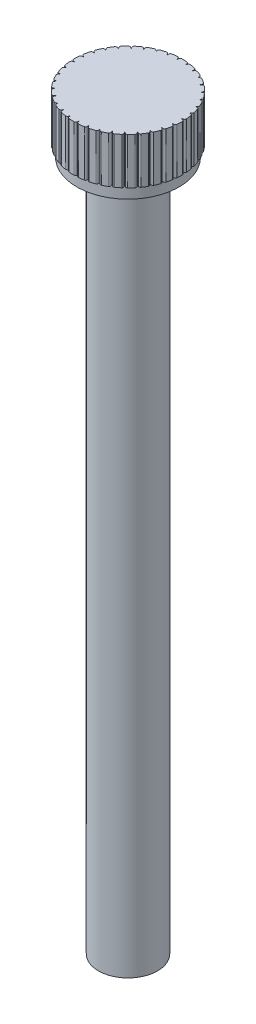
from build123d import *
from OCP.BRepAlgoAPI import BRepAlgoAPI_Cut
from OCP.TopTools import TopTools_ListOfShape

# Parameters (mm, degrees)
ENL_V_MAT_EXTRU_2_DEPTH = 10


with BuildPart() as part:
    # Esquisse1 → Révolution1 (revolve)
    with BuildSketch(Plane.XY):
        Polygon((0, 33.024224269), (-2.75, 33.024224269), (-2.75, 30.675), (-2.6, 30.675), (-2.6, 30.075), (-1.5, 30.075), (-1.5, -4.925), (0, -4.925), align=None)
    revolve(axis=Axis((0, 33.024224269, 0), (0, -1, 0)))


with BuildPart() as enl_v_mat_extru_2_tool:
    # Esquisse2 → Enlèv. mat.-Extru.2 (new body)
    with BuildSketch(Plane(origin=(0, 33.024224269, 0), x_dir=(1, 0, 0), z_dir=(0, 1, 0))):
        with BuildLine():
            Line((0.329583196, 2.654689846), (0.339367819, 2.577754505))
            Line((0.339367819, 2.577754505), (0.36873137, 2.649535892))
            ThreePointArc((0.36873137, 2.649535892), (0.404129914, 2.693729763), (0.457853835, 2.71161539))
            ThreePointArc((0.457853835, 2.71161539), (0.358946748, 2.726471234), (0.259564862, 2.737720628))
            ThreePointArc((0.259564862, 2.737720628), (0.306829044, 2.706539666), (0.329583196, 2.654689846))
        make_face()
        with BuildLine():
            Line((0.785558141, 2.557127621), (0.781834431, 2.479662018))
            Line((0.781834431, 2.479662018), (0.823216591, 2.545253958))
            ThreePointArc((0.823216591, 2.545253958), (0.865751537, 2.582629532), (0.921765077, 2.590914375))
            ThreePointArc((0.921765077, 2.590914375), (0.826940301, 2.622719561), (0.731021687, 2.651055535))
            ThreePointArc((0.731021687, 2.651055535), (0.772153302, 2.612140943), (0.785558141, 2.557127621))
        make_face()
        with BuildLine():
            Line((1.217664299, 2.381868367), (1.2005454, 2.306226256))
            Line((1.2005454, 2.306226256), (1.252688793, 2.36363577))
            ThreePointArc((1.252688793, 2.36363577), (1.301067738, 2.39305741), (1.357668954, 2.391489738))
            ThreePointArc((1.357668954, 2.391489738), (1.269807692, 2.439277881), (1.180266787, 2.483839461))
            ThreePointArc((1.180266787, 2.483839461), (1.214016073, 2.438373638), (1.217664299, 2.381868367))
        make_face()
        with BuildLine():
            Line((1.612772344, 2.134237248), (1.582778404, 2.062716976))
            Line((1.582778404, 2.062716976), (1.644098679, 2.110199706))
            ThreePointArc((1.644098679, 2.110199706), (1.696851654, 2.130773449), (1.752320747, 2.119400896))
            ThreePointArc((1.752320747, 2.119400896), (1.674092619, 2.181719977), (1.593650079, 2.241153181))
            ThreePointArc((1.593650079, 2.241153181), (1.618991579, 2.190517585), (1.612772344, 2.134237248))
        make_face()
        with BuildLine():
            Line((1.958877117, 1.82175841), (1.916919488, 1.756533085))
            Line((1.916919488, 1.756533085), (1.985553459, 1.792646291))
            ThreePointArc((1.985553459, 1.792646291), (2.041077591, 1.803747015), (2.093729161, 1.782915129))
            ThreePointArc((2.093729161, 1.782915129), (2.027511089, 1.857871616), (1.958611119, 1.930370597))
            ThreePointArc((1.958611119, 1.930370597), (1.974774846, 1.876103764), (1.958877117, 1.82175841))
        make_face()
        with BuildLine():
            Line((2.2454624, 1.453926365), (2.192815943, 1.396977825))
            Line((2.192815943, 1.396977825), (2.266678202, 1.420624226))
            ThreePointArc((2.266678202, 1.420624226), (2.323286418, 1.42191464), (2.371520673, 1.392256389))
            ThreePointArc((2.371520673, 1.392256389), (2.31932466, 1.477572766), (2.264060751, 1.560934678))
            ThreePointArc((2.264060751, 1.560934678), (2.270555579, 1.504685478), (2.2454624, 1.453926365))
        make_face()
        with BuildLine():
            Line((2.463820444, 1.041917502), (2.402084795, 0.9949761))
            Line((2.402084795, 0.9949761), (2.478931075, 1.005437213))
            ThreePointArc((2.478931075, 1.005437213), (2.534903363, 0.996878109), (2.57725473, 0.959294643))
            ThreePointArc((2.57725473, 0.959294643), (2.540666725, 1.052378615), (2.500718044, 1.144070549))
            ThreePointArc((2.500718044, 1.144070549), (2.497346629, 1.087548087), (2.463820444, 1.041917502))
        make_face()
        with BuildLine():
            Line((2.607316551, 0.598250504), (2.538367516, 0.56274253))
            Line((2.538367516, 0.56274253), (2.615862882, 0.559700498))
            ThreePointArc((2.615862882, 0.559700498), (2.669498552, 0.541551941), (2.704680206, 0.497185214))
            ThreePointArc((2.704680206, 0.497185214), (2.684811917, 0.595208472), (2.661392284, 0.692444416))
            ThreePointArc((2.661392284, 0.692444416), (2.648257065, 0.637366096), (2.607316551, 0.598250504))
        make_face()
        with BuildLine():
            Line((2.671590664, 0.136405967), (2.597523225, 0.113410313))
            Line((2.597523225, 0.113410313), (2.673313018, 0.096957568))
            ThreePointArc((2.673313018, 0.096957568), (2.722982379, 0.069770992), (2.749925343, 0.019969065))
            ThreePointArc((2.749925343, 0.019969065), (2.747380458, 0.119953221), (2.741201466, 0.219778709))
            ThreePointArc((2.741201466, 0.219778709), (2.718701551, 0.16781806), (2.671590664, 0.136405967))
        make_face()
        with BuildLine():
            Line((2.654689846, -0.329583196), (2.577754505, -0.339367819))
            Line((2.577754505, -0.339367819), (2.649535892, -0.36873137))
            ThreePointArc((2.649535892, -0.36873137), (2.693729763, -0.404129914), (2.71161539, -0.457853835))
            ThreePointArc((2.71161539, -0.457853835), (2.726471234, -0.358946748), (2.737720628, -0.259564862))
            ThreePointArc((2.737720628, -0.259564862), (2.706539666, -0.306829044), (2.654689846, -0.329583196))
        make_face()
        with BuildLine():
            Line((2.557127621, -0.785558141), (2.479662018, -0.781834431))
            Line((2.479662018, -0.781834431), (2.545253958, -0.823216591))
            ThreePointArc((2.545253958, -0.823216591), (2.582629532, -0.865751537), (2.590914375, -0.921765077))
            ThreePointArc((2.590914375, -0.921765077), (2.622719561, -0.826940301), (2.651055535, -0.731021687))
            ThreePointArc((2.651055535, -0.731021687), (2.612140943, -0.772153302), (2.557127621, -0.785558141))
        make_face()
        with BuildLine():
            Line((2.381868367, -1.217664299), (2.306226256, -1.2005454))
            Line((2.306226256, -1.2005454), (2.36363577, -1.252688793))
            ThreePointArc((2.36363577, -1.252688793), (2.39305741, -1.301067738), (2.391489738, -1.357668954))
            ThreePointArc((2.391489738, -1.357668954), (2.439277881, -1.269807692), (2.483839461, -1.180266787))
            ThreePointArc((2.483839461, -1.180266787), (2.438373638, -1.214016073), (2.381868367, -1.217664299))
        make_face()
        with BuildLine():
            Line((2.134237248, -1.612772344), (2.062716976, -1.582778404))
            Line((2.062716976, -1.582778404), (2.110199706, -1.644098679))
            ThreePointArc((2.110199706, -1.644098679), (2.130773449, -1.696851654), (2.119400896, -1.752320747))
            ThreePointArc((2.119400896, -1.752320747), (2.181719977, -1.674092619), (2.241153181, -1.593650079))
            ThreePointArc((2.241153181, -1.593650079), (2.190517585, -1.618991579), (2.134237248, -1.612772344))
        make_face()
        with BuildLine():
            Line((1.82175841, -1.958877117), (1.756533085, -1.916919488))
            Line((1.756533085, -1.916919488), (1.792646291, -1.985553459))
            ThreePointArc((1.792646291, -1.985553459), (1.803747015, -2.041077591), (1.782915129, -2.093729161))
            ThreePointArc((1.782915129, -2.093729161), (1.857871616, -2.027511089), (1.930370597, -1.958611119))
            ThreePointArc((1.930370597, -1.958611119), (1.876103764, -1.974774846), (1.82175841, -1.958877117))
        make_face()
        with BuildLine():
            Line((1.453926365, -2.2454624), (1.396977825, -2.192815943))
            Line((1.396977825, -2.192815943), (1.420624226, -2.266678202))
            ThreePointArc((1.420624226, -2.266678202), (1.42191464, -2.323286418), (1.392256389, -2.371520673))
            ThreePointArc((1.392256389, -2.371520673), (1.477572766, -2.31932466), (1.560934678, -2.264060751))
            ThreePointArc((1.560934678, -2.264060751), (1.504685478, -2.270555579), (1.453926365, -2.2454624))
        make_face()
        with BuildLine():
            Line((1.041917502, -2.463820444), (0.9949761, -2.402084795))
            Line((0.9949761, -2.402084795), (1.005437213, -2.478931075))
            ThreePointArc((1.005437213, -2.478931075), (0.996878109, -2.534903363), (0.959294643, -2.57725473))
            ThreePointArc((0.959294643, -2.57725473), (1.052378615, -2.540666725), (1.144070549, -2.500718044))
            ThreePointArc((1.144070549, -2.500718044), (1.087548087, -2.497346629), (1.041917502, -2.463820444))
        make_face()
        with BuildLine():
            Line((0.598250504, -2.607316551), (0.56274253, -2.538367516))
            Line((0.56274253, -2.538367516), (0.559700498, -2.615862882))
            ThreePointArc((0.559700498, -2.615862882), (0.541551941, -2.669498552), (0.497185214, -2.704680206))
            ThreePointArc((0.497185214, -2.704680206), (0.595208472, -2.684811917), (0.692444416, -2.661392284))
            ThreePointArc((0.692444416, -2.661392284), (0.637366096, -2.648257065), (0.598250504, -2.607316551))
        make_face()
        with BuildLine():
            Line((0.136405967, -2.671590664), (0.113410313, -2.597523225))
            Line((0.113410313, -2.597523225), (0.096957568, -2.673313018))
            ThreePointArc((0.096957568, -2.673313018), (0.069770992, -2.722982379), (0.019969065, -2.749925343))
            ThreePointArc((0.019969065, -2.749925343), (0.119953221, -2.747380458), (0.219778709, -2.741201466))
            ThreePointArc((0.219778709, -2.741201466), (0.16781806, -2.718701551), (0.136405967, -2.671590664))
        make_face()
        with BuildLine():
            Line((-0.329583196, -2.654689846), (-0.339367819, -2.577754505))
            Line((-0.339367819, -2.577754505), (-0.36873137, -2.649535892))
            ThreePointArc((-0.36873137, -2.649535892), (-0.404129914, -2.693729763), (-0.457853835, -2.71161539))
            ThreePointArc((-0.457853835, -2.71161539), (-0.358946748, -2.726471234), (-0.259564862, -2.737720628))
            ThreePointArc((-0.259564862, -2.737720628), (-0.306829044, -2.706539666), (-0.329583196, -2.654689846))
        make_face()
        with BuildLine():
            Line((-0.785558141, -2.557127621), (-0.781834431, -2.479662018))
            Line((-0.781834431, -2.479662018), (-0.823216591, -2.545253958))
            ThreePointArc((-0.823216591, -2.545253958), (-0.865751537, -2.582629532), (-0.921765077, -2.590914375))
            ThreePointArc((-0.921765077, -2.590914375), (-0.826940301, -2.622719561), (-0.731021687, -2.651055535))
            ThreePointArc((-0.731021687, -2.651055535), (-0.772153302, -2.612140943), (-0.785558141, -2.557127621))
        make_face()
        with BuildLine():
            Line((-1.217664299, -2.381868367), (-1.2005454, -2.306226256))
            Line((-1.2005454, -2.306226256), (-1.252688793, -2.36363577))
            ThreePointArc((-1.252688793, -2.36363577), (-1.301067738, -2.39305741), (-1.357668954, -2.391489738))
            ThreePointArc((-1.357668954, -2.391489738), (-1.269807692, -2.439277881), (-1.180266787, -2.483839461))
            ThreePointArc((-1.180266787, -2.483839461), (-1.214016073, -2.438373638), (-1.217664299, -2.381868367))
        make_face()
        with BuildLine():
            Line((-1.612772344, -2.134237248), (-1.582778404, -2.062716976))
            Line((-1.582778404, -2.062716976), (-1.644098679, -2.110199706))
            ThreePointArc((-1.644098679, -2.110199706), (-1.696851654, -2.130773449), (-1.752320747, -2.119400896))
            ThreePointArc((-1.752320747, -2.119400896), (-1.674092619, -2.181719977), (-1.593650079, -2.241153181))
            ThreePointArc((-1.593650079, -2.241153181), (-1.618991579, -2.190517585), (-1.612772344, -2.134237248))
        make_face()
        with BuildLine():
            Line((-1.958877117, -1.82175841), (-1.916919488, -1.756533085))
            Line((-1.916919488, -1.756533085), (-1.985553459, -1.792646291))
            ThreePointArc((-1.985553459, -1.792646291), (-2.041077591, -1.803747015), (-2.093729161, -1.782915129))
            ThreePointArc((-2.093729161, -1.782915129), (-2.027511089, -1.857871616), (-1.958611119, -1.930370597))
            ThreePointArc((-1.958611119, -1.930370597), (-1.974774846, -1.876103764), (-1.958877117, -1.82175841))
        make_face()
        with BuildLine():
            Line((-2.2454624, -1.453926365), (-2.192815943, -1.396977825))
            Line((-2.192815943, -1.396977825), (-2.266678202, -1.420624226))
            ThreePointArc((-2.266678202, -1.420624226), (-2.323286418, -1.42191464), (-2.371520673, -1.392256389))
            ThreePointArc((-2.371520673, -1.392256389), (-2.31932466, -1.477572766), (-2.264060751, -1.560934678))
            ThreePointArc((-2.264060751, -1.560934678), (-2.270555579, -1.504685478), (-2.2454624, -1.453926365))
        make_face()
        with BuildLine():
            Line((-2.463820444, -1.041917502), (-2.402084795, -0.9949761))
            Line((-2.402084795, -0.9949761), (-2.478931075, -1.005437213))
            ThreePointArc((-2.478931075, -1.005437213), (-2.534903363, -0.996878109), (-2.57725473, -0.959294643))
            ThreePointArc((-2.57725473, -0.959294643), (-2.540666725, -1.052378615), (-2.500718044, -1.144070549))
            ThreePointArc((-2.500718044, -1.144070549), (-2.497346629, -1.087548087), (-2.463820444, -1.041917502))
        make_face()
        with BuildLine():
            Line((-2.607316551, -0.598250504), (-2.538367516, -0.56274253))
            Line((-2.538367516, -0.56274253), (-2.615862882, -0.559700498))
            ThreePointArc((-2.615862882, -0.559700498), (-2.669498552, -0.541551941), (-2.704680206, -0.497185214))
            ThreePointArc((-2.704680206, -0.497185214), (-2.684811917, -0.595208472), (-2.661392284, -0.692444416))
            ThreePointArc((-2.661392284, -0.692444416), (-2.648257065, -0.637366096), (-2.607316551, -0.598250504))
        make_face()
        with BuildLine():
            Line((-2.671590664, -0.136405967), (-2.597523225, -0.113410313))
            Line((-2.597523225, -0.113410313), (-2.673313018, -0.096957568))
            ThreePointArc((-2.673313018, -0.096957568), (-2.722982379, -0.069770992), (-2.749925343, -0.019969065))
            ThreePointArc((-2.749925343, -0.019969065), (-2.747380458, -0.119953221), (-2.741201466, -0.219778709))
            ThreePointArc((-2.741201466, -0.219778709), (-2.718701551, -0.16781806), (-2.671590664, -0.136405967))
        make_face()
        with BuildLine():
            Line((-2.654689846, 0.329583196), (-2.577754505, 0.339367819))
            Line((-2.577754505, 0.339367819), (-2.649535892, 0.36873137))
            ThreePointArc((-2.649535892, 0.36873137), (-2.693729763, 0.404129914), (-2.71161539, 0.457853835))
            ThreePointArc((-2.71161539, 0.457853835), (-2.726471234, 0.358946748), (-2.737720628, 0.259564862))
            ThreePointArc((-2.737720628, 0.259564862), (-2.706539666, 0.306829044), (-2.654689846, 0.329583196))
        make_face()
        with BuildLine():
            Line((-2.557127621, 0.785558141), (-2.479662018, 0.781834431))
            Line((-2.479662018, 0.781834431), (-2.545253958, 0.823216591))
            ThreePointArc((-2.545253958, 0.823216591), (-2.582629532, 0.865751537), (-2.590914375, 0.921765077))
            ThreePointArc((-2.590914375, 0.921765077), (-2.622719561, 0.826940301), (-2.651055535, 0.731021687))
            ThreePointArc((-2.651055535, 0.731021687), (-2.612140943, 0.772153302), (-2.557127621, 0.785558141))
        make_face()
        with BuildLine():
            Line((-2.381868367, 1.217664299), (-2.306226256, 1.2005454))
            Line((-2.306226256, 1.2005454), (-2.36363577, 1.252688793))
            ThreePointArc((-2.36363577, 1.252688793), (-2.39305741, 1.301067738), (-2.391489738, 1.357668954))
            ThreePointArc((-2.391489738, 1.357668954), (-2.439277881, 1.269807692), (-2.483839461, 1.180266787))
            ThreePointArc((-2.483839461, 1.180266787), (-2.438373638, 1.214016073), (-2.381868367, 1.217664299))
        make_face()
        with BuildLine():
            Line((-2.134237248, 1.612772344), (-2.062716976, 1.582778404))
            Line((-2.062716976, 1.582778404), (-2.110199706, 1.644098679))
            ThreePointArc((-2.110199706, 1.644098679), (-2.130773449, 1.696851654), (-2.119400896, 1.752320747))
            ThreePointArc((-2.119400896, 1.752320747), (-2.181719977, 1.674092619), (-2.241153181, 1.593650079))
            ThreePointArc((-2.241153181, 1.593650079), (-2.190517585, 1.618991579), (-2.134237248, 1.612772344))
        make_face()
        with BuildLine():
            Line((-1.82175841, 1.958877117), (-1.756533085, 1.916919488))
            Line((-1.756533085, 1.916919488), (-1.792646291, 1.985553459))
            ThreePointArc((-1.792646291, 1.985553459), (-1.803747015, 2.041077591), (-1.782915129, 2.093729161))
            ThreePointArc((-1.782915129, 2.093729161), (-1.857871616, 2.027511089), (-1.930370597, 1.958611119))
            ThreePointArc((-1.930370597, 1.958611119), (-1.876103764, 1.974774846), (-1.82175841, 1.958877117))
        make_face()
        with BuildLine():
            Line((-1.453926365, 2.2454624), (-1.396977825, 2.192815943))
            Line((-1.396977825, 2.192815943), (-1.420624226, 2.266678202))
            ThreePointArc((-1.420624226, 2.266678202), (-1.42191464, 2.323286418), (-1.392256389, 2.371520673))
            ThreePointArc((-1.392256389, 2.371520673), (-1.477572766, 2.31932466), (-1.560934678, 2.264060751))
            ThreePointArc((-1.560934678, 2.264060751), (-1.504685478, 2.270555579), (-1.453926365, 2.2454624))
        make_face()
        with BuildLine():
            Line((-1.041917502, 2.463820444), (-0.9949761, 2.402084795))
            Line((-0.9949761, 2.402084795), (-1.005437213, 2.478931075))
            ThreePointArc((-1.005437213, 2.478931075), (-0.996878109, 2.534903363), (-0.959294643, 2.57725473))
            ThreePointArc((-0.959294643, 2.57725473), (-1.052378615, 2.540666725), (-1.144070549, 2.500718044))
            ThreePointArc((-1.144070549, 2.500718044), (-1.087548087, 2.497346629), (-1.041917502, 2.463820444))
        make_face()
        with BuildLine():
            Line((-0.598250504, 2.607316551), (-0.56274253, 2.538367516))
            Line((-0.56274253, 2.538367516), (-0.559700498, 2.615862882))
            ThreePointArc((-0.559700498, 2.615862882), (-0.541551941, 2.669498552), (-0.497185214, 2.704680206))
            ThreePointArc((-0.497185214, 2.704680206), (-0.595208472, 2.684811917), (-0.692444416, 2.661392284))
            ThreePointArc((-0.692444416, 2.661392284), (-0.637366096, 2.648257065), (-0.598250504, 2.607316551))
        make_face()
        with BuildLine():
            Line((-0.136405967, 2.671590664), (-0.113410313, 2.597523225))
            Line((-0.113410313, 2.597523225), (-0.096957568, 2.673313018))
            ThreePointArc((-0.096957568, 2.673313018), (-0.069770992, 2.722982379), (-0.019969065, 2.749925343))
            ThreePointArc((-0.019969065, 2.749925343), (-0.119953221, 2.747380458), (-0.219778709, 2.741201466))
            ThreePointArc((-0.219778709, 2.741201466), (-0.16781806, 2.718701551), (-0.136405967, 2.671590664))
        make_face()
    extrude(amount=-ENL_V_MAT_EXTRU_2_DEPTH)


with BuildPart() as part_1:
    add(part.part)

    # Enlèv. mat.-Extru.2: cut by enl_v_mat_extru_2_tool, with a tolerance
    enl_v_mat_extru_2_stock = TopTools_ListOfShape()
    enl_v_mat_extru_2_stock.Append(part_1.part.wrapped)
    enl_v_mat_extru_2_tools = TopTools_ListOfShape()
    enl_v_mat_extru_2_tools.Append(enl_v_mat_extru_2_tool.part.wrapped)
    enl_v_mat_extru_2_cut = BRepAlgoAPI_Cut()
    enl_v_mat_extru_2_cut.SetArguments(enl_v_mat_extru_2_stock)
    enl_v_mat_extru_2_cut.SetTools(enl_v_mat_extru_2_tools)
    enl_v_mat_extru_2_cut.SetFuzzyValue(0.00001)
    enl_v_mat_extru_2_cut.Build()
    add(Compound.cast(enl_v_mat_extru_2_cut.Shape()).solids(), mode=Mode.REPLACE)


solid = part_1.part
